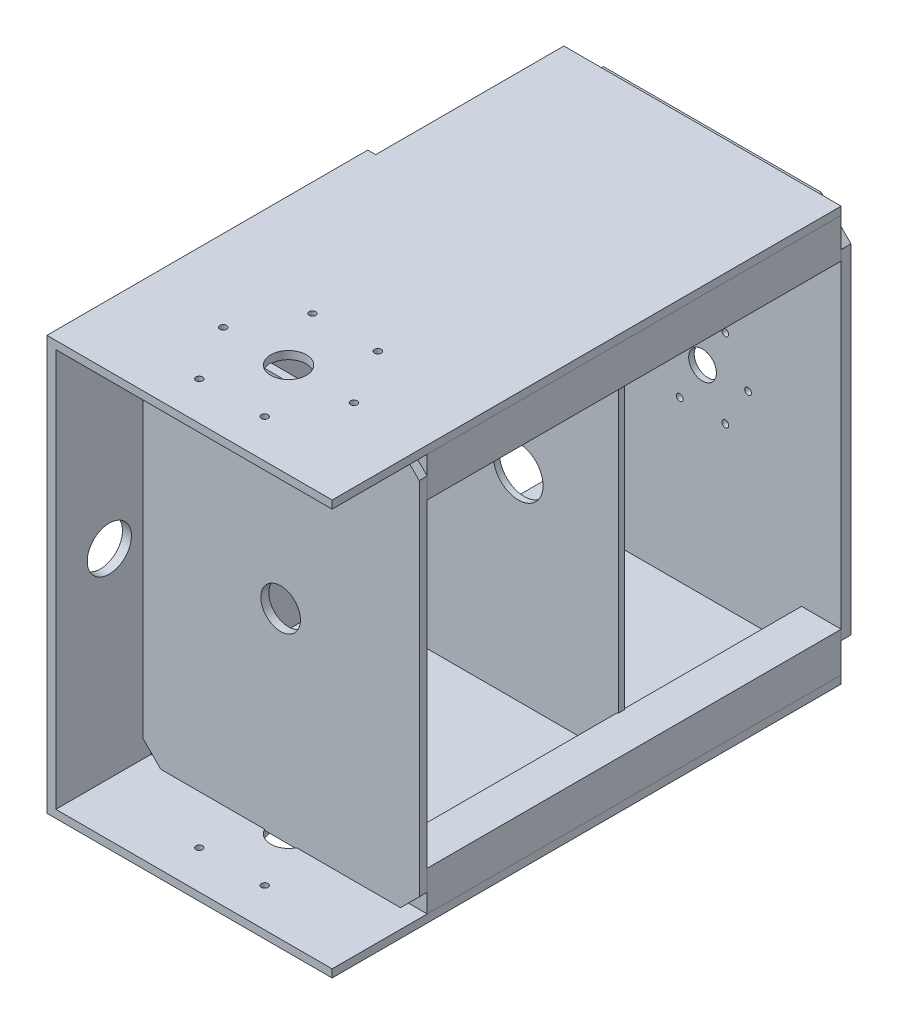
from build123d import *

# Parameters (mm, degrees)
SK_BOTTOM_PLATE_R        = 1.7
SK_BOTTOM_PLATE_R_2      = 7
SK_BOTTOM_PLATE_R_3      = 2.75
BOTTOM_PLATE_DEPTH       = 5
SK_WAIST_PILOT_RECESS_R  = 17.15
WAIST_PILOT_RECESS_DEPTH = 2.2
SK_SIDE_LEFT_W           = 140
SK_SIDE_LEFT_H           = 257
SK_SIDE_LEFT_R           = 1.7
SK_SIDE_LEFT_R_2         = 9
SIDE_LEFT_DEPTH          = 4
SK_SIDE_RIGHT_W          = 140
SK_SIDE_RIGHT_H          = 257
SK_SIDE_RIGHT_R          = 1.7
SK_SIDE_RIGHT_R_2        = 9
SIDE_RIGHT_DEPTH         = 4
SK_DECK_R                = 10
DECK_DEPTH               = 4
SK_TRAY_W                = 101
SK_TRAY_H                = 202
SK_TRAY_R                = 12.5
TRAY_DEPTH               = 3
SK_BACK_PLATE_W          = 162
SK_BACK_PLATE_H          = 209
SK_BACK_PLATE_R          = 11.15
BACK_PLATE_DEPTH         = 4.5
SK_POST_0_W              = 20
SK_POST_0_H              = 20
POST_0_DEPTH             = 209
SK_POST_1_W              = 20
SK_POST_1_H              = 20
POST_1_DEPTH             = 209
SK_POST_2_W              = 20
SK_POST_2_H              = 20
POST_2_DEPTH             = 209
SK_POST_3_W              = 20
SK_POST_3_H              = 20
POST_3_DEPTH             = 209


with BuildPart() as part:
    # SK_Bottom_Plate → Bottom_Plate (new body)
    with BuildSketch(Plane.XY):
        Polygon((-55, -100.5), (55, -100.5), (70, -85.5), (70, 85.5), (55, 100.5), (-55, 100.5), (-70, 85.5), (-70, -85.5), align=None)
        with Locations((23, 0)):
            Circle(SK_BOTTOM_PLATE_R, mode=Mode.SUBTRACT)
        with Locations((11.5, 19.918584287)):
            Circle(SK_BOTTOM_PLATE_R, mode=Mode.SUBTRACT)
        with Locations((-11.5, 19.918584287)):
            Circle(SK_BOTTOM_PLATE_R, mode=Mode.SUBTRACT)
        with Locations((-23, 0)):
            Circle(SK_BOTTOM_PLATE_R, mode=Mode.SUBTRACT)
        with Locations((-11.5, -19.918584287)):
            Circle(SK_BOTTOM_PLATE_R, mode=Mode.SUBTRACT)
        with Locations((11.5, -19.918584287)):
            Circle(SK_BOTTOM_PLATE_R, mode=Mode.SUBTRACT)
        Circle(SK_BOTTOM_PLATE_R_2, mode=Mode.SUBTRACT)
        with Locations((60, 90.5)):
            Circle(SK_BOTTOM_PLATE_R_3, mode=Mode.SUBTRACT)
        with Locations((60, -90.5)):
            Circle(SK_BOTTOM_PLATE_R_3, mode=Mode.SUBTRACT)
        with Locations((-60, 90.5)):
            Circle(SK_BOTTOM_PLATE_R_3, mode=Mode.SUBTRACT)
        with Locations((-60, -90.5)):
            Circle(SK_BOTTOM_PLATE_R_3, mode=Mode.SUBTRACT)
    extrude(amount=BOTTOM_PLATE_DEPTH)

    # SK_Waist_Pilot_Recess → Waist_Pilot_Recess (cut)
    with BuildSketch(Plane.XY):
        Circle(SK_WAIST_PILOT_RECESS_R)
    extrude(amount=WAIST_PILOT_RECESS_DEPTH, mode=Mode.SUBTRACT)


with BuildPart() as body_2:
    # SK_Side_Left → Side_Left (new body)
    with BuildSketch(Plane(origin=(0, 100.5, 0), x_dir=(1, 0, 0), z_dir=(0, 1, 0))):
        with Locations((0, -133.5)):
            Rectangle(SK_SIDE_LEFT_W, SK_SIDE_LEFT_H)
        with Locations((33, -214)):
            Circle(SK_SIDE_LEFT_R, mode=Mode.SUBTRACT)
        with Locations((16.5, -185.421161675)):
            Circle(SK_SIDE_LEFT_R, mode=Mode.SUBTRACT)
        with Locations((-16.5, -185.421161675)):
            Circle(SK_SIDE_LEFT_R, mode=Mode.SUBTRACT)
        with Locations((-33, -214)):
            Circle(SK_SIDE_LEFT_R, mode=Mode.SUBTRACT)
        with Locations((-16.5, -242.578838325)):
            Circle(SK_SIDE_LEFT_R, mode=Mode.SUBTRACT)
        with Locations((16.5, -242.578838325)):
            Circle(SK_SIDE_LEFT_R, mode=Mode.SUBTRACT)
        with Locations((0, -214)):
            Circle(SK_SIDE_LEFT_R_2, mode=Mode.SUBTRACT)
    extrude(amount=SIDE_LEFT_DEPTH)



with BuildPart() as body_3:
    # SK_Side_Right → Side_Right (new body)
    with BuildSketch(Plane(origin=(0, -104.5, 0), x_dir=(1, 0, 0), z_dir=(0, 1, 0))):
        with Locations((0, -133.5)):
            Rectangle(SK_SIDE_RIGHT_W, SK_SIDE_RIGHT_H)
        with Locations((33, -214)):
            Circle(SK_SIDE_RIGHT_R, mode=Mode.SUBTRACT)
        with Locations((16.5, -185.421161675)):
            Circle(SK_SIDE_RIGHT_R, mode=Mode.SUBTRACT)
        with Locations((-16.5, -185.421161675)):
            Circle(SK_SIDE_RIGHT_R, mode=Mode.SUBTRACT)
        with Locations((-33, -214)):
            Circle(SK_SIDE_RIGHT_R, mode=Mode.SUBTRACT)
        with Locations((-16.5, -242.578838325)):
            Circle(SK_SIDE_RIGHT_R, mode=Mode.SUBTRACT)
        with Locations((16.5, -242.578838325)):
            Circle(SK_SIDE_RIGHT_R, mode=Mode.SUBTRACT)
        with Locations((0, -214)):
            Circle(SK_SIDE_RIGHT_R_2, mode=Mode.SUBTRACT)
    extrude(amount=SIDE_RIGHT_DEPTH)


with BuildPart() as body_2_1:
    add(body_2.part)

    add(body_3.part)  # Deck merges body 3
    # SK_Deck → Deck (add)
    with BuildSketch(Plane.XY.offset(214)):
        Polygon((-60, -101), (60, -101), (70, -91), (70, 91), (60, 101), (-60, 101), (-70, 91), (-70, -91), align=None)
        Circle(SK_DECK_R, mode=Mode.SUBTRACT)
    extrude(amount=DECK_DEPTH)

    # SK_Tray → Tray (add)
    with BuildSketch(Plane.XY.offset(95)):
        Rectangle(SK_TRAY_W, SK_TRAY_H)
        Circle(SK_TRAY_R, mode=Mode.SUBTRACT)
    extrude(amount=TRAY_DEPTH)

    # SK_Back_Plate → Back_Plate (add)
    with BuildSketch(Plane(origin=(-74, 0, 0), x_dir=(0, 0, -1), z_dir=(1, 0, 0))):
        with Locations((-181, 0)):
            Rectangle(SK_BACK_PLATE_W, SK_BACK_PLATE_H)
        with Locations((-235, 0)):
            Circle(SK_BACK_PLATE_R, mode=Mode.SUBTRACT)
    extrude(amount=BACK_PLATE_DEPTH)


with BuildPart() as body_3_2:
    # SK_Post_0 → Post_0 (new body)
    with BuildSketch(Plane.XY.offset(5)):
        with Locations((60, 90.5)):
            Rectangle(SK_POST_0_W, SK_POST_0_H)
    extrude(amount=POST_0_DEPTH)


with BuildPart() as body_4:
    # SK_Post_1 → Post_1 (new body)
    with BuildSketch(Plane.XY.offset(5)):
        with Locations((60, -90.5)):
            Rectangle(SK_POST_1_W, SK_POST_1_H)
    extrude(amount=POST_1_DEPTH)


with BuildPart() as body_5:
    # SK_Post_2 → Post_2 (new body)
    with BuildSketch(Plane.XY.offset(5)):
        with Locations((-60, 90.5)):
            Rectangle(SK_POST_2_W, SK_POST_2_H)
    extrude(amount=POST_2_DEPTH)


with BuildPart() as body_6:
    # SK_Post_3 → Post_3 (new body)
    with BuildSketch(Plane.XY.offset(5)):
        with Locations((-60, -90.5)):
            Rectangle(SK_POST_3_W, SK_POST_3_H)
    extrude(amount=POST_3_DEPTH)


solid = Compound([part.part, body_2_1.part, body_3_2.part, body_4.part, body_5.part, body_6.part])
